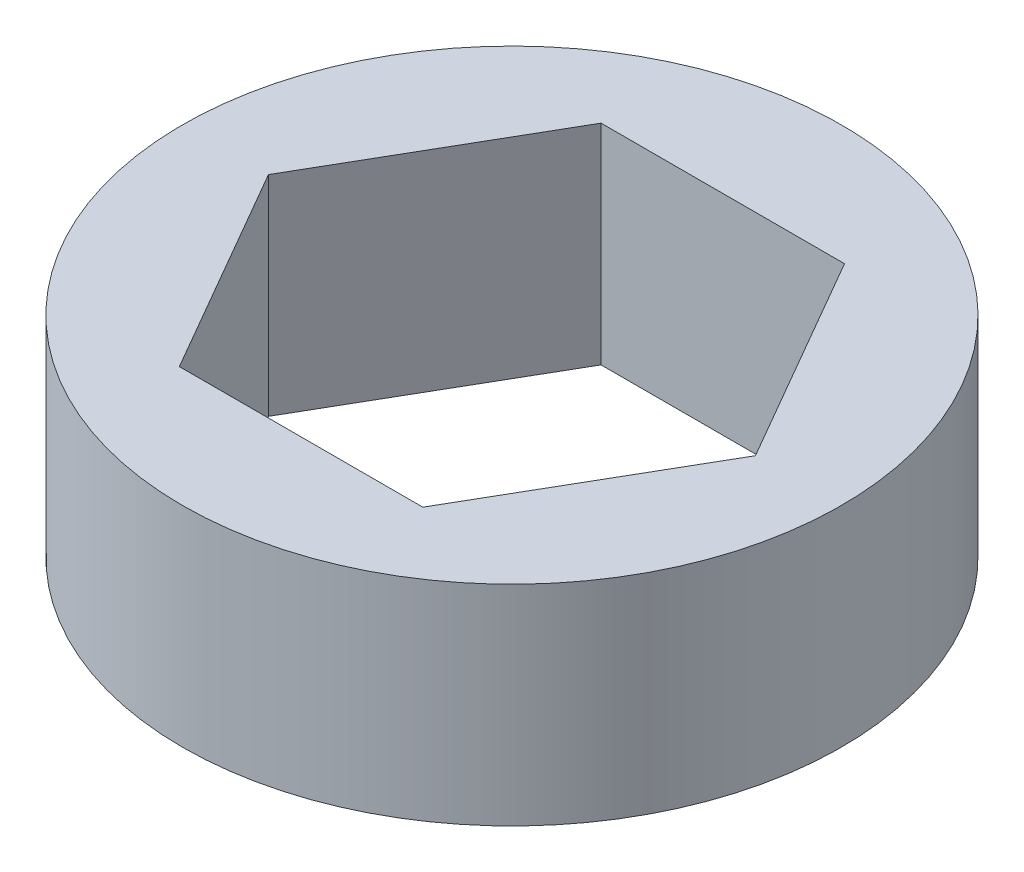
from build123d import *

# Parameters (mm, degrees)
SKETCH1_R           = 9.9949
BOSS_EXTRUDE1_DEPTH = 6.35


with BuildPart() as part:
    # Sketch1 → Boss-Extrude1 (new body)
    with BuildSketch(Plane(origin=(0, 0, 0), x_dir=(1, 0, 0), z_dir=(0, 1, 0))):
        Circle(SKETCH1_R)
        Polygon((7.383674858, 0), (3.691837429, 6.39445), (-3.691837429, 6.39445), (-7.383674858, 0), (-3.691837429, -6.39445), (3.691837429, -6.39445), align=None, mode=Mode.SUBTRACT)
    extrude(amount=BOSS_EXTRUDE1_DEPTH)


solid = part.part
